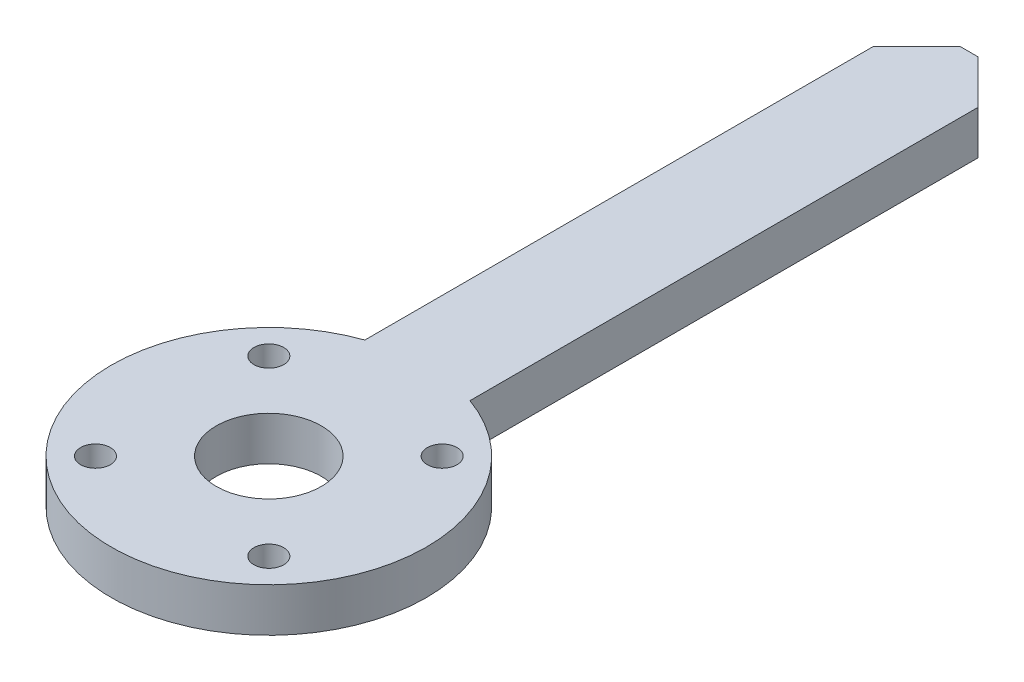
from build123d import *

# Parameters (mm, degrees)
SKETCH1_R           = 18
BOSS_EXTRUDE2_DEPTH = 5
SKETCH2_W           = 12
SKETCH2_H           = 80
BOSS_EXTRUDE3_DEPTH = 5
SKETCH3_R           = 1.7
SKETCH3_R_2         = 6
CUT_EXTRUDE1_DEPTH  = 83.152297594
CHAMFER1_SIZE       = 5


with BuildPart() as part:
    # Sketch1 → Boss-Extrude2 (new body)
    with BuildSketch(Plane(origin=(0, 0, 0), x_dir=(1, 0, 0), z_dir=(0, 1, 0))):
        Circle(SKETCH1_R)
    extrude(amount=BOSS_EXTRUDE2_DEPTH)

    # Sketch2 → Boss-Extrude3 (add)
    with BuildSketch(Plane(origin=(0, 0, 0), x_dir=(1, 0, 0), z_dir=(0, 1, 0))):
        with Locations((0, 40)):
            Rectangle(SKETCH2_W, SKETCH2_H)
    extrude(amount=BOSS_EXTRUDE3_DEPTH)

    # Sketch3 → Cut-Extrude1 (cut, through all)
    with BuildSketch(Plane(origin=(0, 0, 0), x_dir=(1, 0, 0), z_dir=(0, 1, 0))):
        with Locations((9.899494937, 9.899494937)):
            Circle(SKETCH3_R)
        with Locations((9.899494937, -9.899494937)):
            Circle(SKETCH3_R)
        with Locations((-9.899494937, -9.899494937)):
            Circle(SKETCH3_R)
        with Locations((-9.899494937, 9.899494937)):
            Circle(SKETCH3_R)
        Circle(SKETCH3_R_2)
    extrude(amount=CUT_EXTRUDE1_DEPTH, mode=Mode.SUBTRACT)

    # Chamfer1
    chamfer1_edges = [part.edges().sort_by_distance(p)[0] for p in [
        (-6, 2.5, -80),
        (6, 2.5, -80),
    ]]
    chamfer(chamfer1_edges, length=CHAMFER1_SIZE)


solid = part.part
